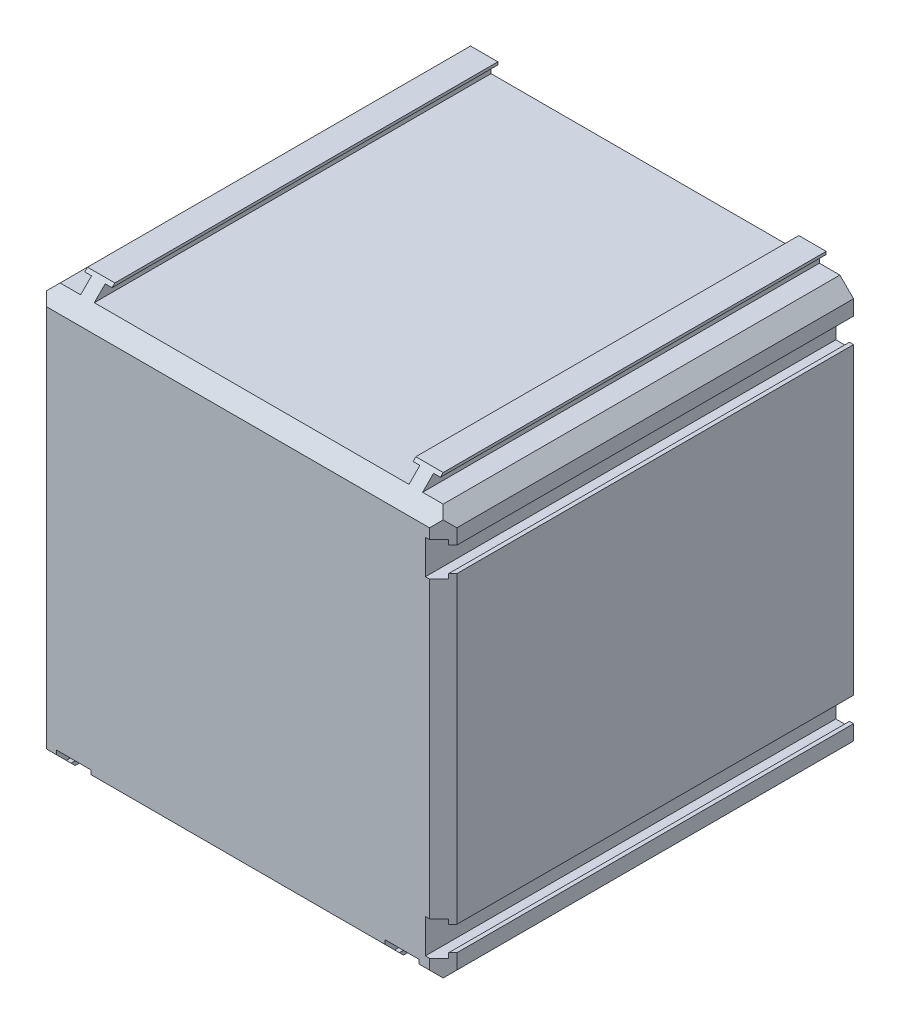
from build123d import *

# Parameters (mm, degrees)
SKETCH_1_W                      = 30
SKETCH_1_H                      = 30
EXTRUDE_1_DEPTH                 = 30
CHAMFER_6_SIZE                  = 1
EXTRUDE_3_DEPTH                 = 40
PATTERN_CIRCULAR_8_COUNT        = 2
PATTERN_CIRCULAR_8_ANGLE        = 270
PATTERN_CIRCULAR_8_COPY_1_DEPTH = 40
SKETCH_16_W                     = 12.549729198
SKETCH_16_H                     = 35.597789554
CUT_EXTRUDE_8_DEPTH             = 50
SKETCH_17_W                     = 46.119781587
SKETCH_17_H                     = 25.089994046
CUT_EXTRUDE_10_DEPTH            = 50
CUT_EXTRUDE_2_DEPTH             = 30
PATTERN_CIRCULAR_1_COUNT        = 2
PATTERN_CIRCULAR_1_ANGLE        = 270
PATTERN_CIRCULAR_1_COPY_1_DEPTH = 30
CHAMFER_5_SIZE                  = 1
SKETCH_2_W                      = 26
SKETCH_2_H                      = 26
CUT_EXTRUDE_1_DEPTH             = 28
FILLET_1_R                      = 2
CHAMFER_1_SIZE                  = 1.5
CUT_EXTRUDE_3_DEPTH             = 25
SKETCH_12_W                     = 10
SKETCH_12_H                     = 2
EXTRUDE_6_DEPTH                 = 2
SKETCH_13_R                     = 0.5
CUT_EXTRUDE_6_DEPTH             = 40.446165847
SKETCH_14_W                     = 0.5
SKETCH_14_H                     = 0.5
CUT_EXTRUDE_7_DEPTH             = 1
CHAMFER_8_SIZE                  = 0.5
FILLET_6_R                      = 0.3


with BuildPart() as part:
    # 草图1 → 凸台-拉伸1 (new body)
    with BuildSketch(Plane.XY):
        Rectangle(SKETCH_1_W, SKETCH_1_H)
    extrude(amount=EXTRUDE_1_DEPTH)

    # 倒角6
    chamfer_6_edges = [part.edges().sort_by_distance(p)[0] for p in [
        (-15, 0, 30),
        (0, -15, 30),
        (15, 0, 30),
        (0, 15, 30),
    ]]
    chamfer(chamfer_6_edges, length=CHAMFER_6_SIZE)

    # 草图6 → 凸台-拉伸3 (add)
    with BuildSketch(Plane.XY):
        Polygon((-12.5, 15), (-11.5, 15), (-11.5, 15.8), (-11, 15.8), (-11, 16), (-13, 16), (-13, 15.8), (-12.5, 15.8), align=None)
    extrude_3 = extrude(amount=EXTRUDE_3_DEPTH)

    # 镜向4: 凸台-拉伸3 across plane
    add(extrude_3.mirror(Plane(origin=(0, 0, 0), x_dir=(0, 0, 1), z_dir=(1, 0, 0))))

    # 阵列(圆周)8: 凸台-拉伸3 ×2 about axis
    pattern_circular_8_axis = Axis((0, 0, 0), (0, 0, -1))
    for i in range(1, PATTERN_CIRCULAR_8_COUNT):
        add(extrude_3.rotate(pattern_circular_8_axis, i * PATTERN_CIRCULAR_8_ANGLE / (PATTERN_CIRCULAR_8_COUNT - 1)))

    # 阵列(圆周)8 copy 1 sketch → 阵列(圆周)8 copy 1 (add)
    with BuildSketch(Plane(origin=(0, 0, 0), x_dir=(0, -1, 0), z_dir=(0, 0, 1))):
        Polygon((-12.5, -15), (-11.5, -15), (-11.5, -15.8), (-11, -15.8), (-11, -16), (-13, -16), (-13, -15.8), (-12.5, -15.8), align=None)
    extrude(amount=PATTERN_CIRCULAR_8_COPY_1_DEPTH)

    # 草图16 → 切除-拉伸8 (cut, along a direction that is not the sketch's normal)
    with BuildSketch(Plane(origin=(-22, 0, 22), x_dir=(0.7071067811865475, 0, 0.7071067811865477), z_dir=(-0.7071067811865477, 0, 0.7071067811865475))):
        with Locations((10.913675879, 1.48547553)):
            Rectangle(SKETCH_16_W, SKETCH_16_H)
    extrude(amount=CUT_EXTRUDE_8_DEPTH, dir=(0, 0, 1), mode=Mode.SUBTRACT)

    # 草图17 → 切除-拉伸10 (cut, along a direction that is not the sketch's normal)
    with BuildSketch(Plane(origin=(0, 22, 22), x_dir=(1, 0, 0), z_dir=(0, 0.7071067811865477, 0.7071067811865475))):
        with Locations((-2.061617887, -8.781830855)):
            Rectangle(SKETCH_17_W, SKETCH_17_H)
    extrude(amount=CUT_EXTRUDE_10_DEPTH, dir=(0, 0, 1), mode=Mode.SUBTRACT)

    # 草图8 → 切除-拉伸2 (cut)
    with BuildSketch(Plane.XY.offset(30)):
        Polygon((-12.9, -15), (-11.1, -15), (-11.1, -14.7), (-10.75, -14.7), (-10.75, -13.7), (-13.25, -13.7), (-13.25, -14.7), (-12.9, -14.7), align=None)
    cut_extrude_2 = extrude(amount=-CUT_EXTRUDE_2_DEPTH, mode=Mode.SUBTRACT)

    # 镜向1: 切除-拉伸2 across plane
    add(cut_extrude_2.mirror(Plane(origin=(0, 0, 0), x_dir=(0, 0, 1), z_dir=(1, 0, 0))), mode=Mode.SUBTRACT)

    # 阵列(圆周)1: 切除-拉伸2 ×2 about axis
    pattern_circular_1_axis = Axis((0, 0, 0), (0, 0, -1))
    for i in range(1, PATTERN_CIRCULAR_1_COUNT):
        add(cut_extrude_2.rotate(pattern_circular_1_axis, i * PATTERN_CIRCULAR_1_ANGLE / (PATTERN_CIRCULAR_1_COUNT - 1)), mode=Mode.SUBTRACT)

    # 阵列(圆周)1 copy 1 sketch → 阵列(圆周)1 copy 1 (cut)
    with BuildSketch(Plane(origin=(0, 0, 30), x_dir=(0, -1, 0), z_dir=(0, 0, 1))):
        Polygon((-12.9, 15), (-11.1, 15), (-11.1, 14.7), (-10.75, 14.7), (-10.75, 13.7), (-13.25, 13.7), (-13.25, 14.7), (-12.9, 14.7), align=None)
    extrude(amount=-PATTERN_CIRCULAR_1_COPY_1_DEPTH, mode=Mode.SUBTRACT)

    # 倒角5
    chamfer_5_edges = [part.edges().sort_by_distance(p)[0] for p in [
        (15, -15, 14.5),
        (-15, -15, 14.5),
        (15, 15, 14.5),
        (-15, 15, 14.5),
    ]]
    chamfer(chamfer_5_edges, length=CHAMFER_5_SIZE)

    # 草图2 → 切除-拉伸1 (cut)
    with BuildSketch(Plane(origin=(0, 0, 0), x_dir=(-1, 0, 0), z_dir=(0, 0, -1))):
        Rectangle(SKETCH_2_W, SKETCH_2_H)
    extrude(amount=-CUT_EXTRUDE_1_DEPTH, mode=Mode.SUBTRACT)

    # 圆角1
    fillet_1_edges = [part.edges().sort_by_distance(p)[0] for p in [
        (13, -13, 14),
        (-13, -13, 14),
    ]]
    fillet(fillet_1_edges, radius=FILLET_1_R)

    # 倒角1
    chamfer_1_edges = [part.edges().sort_by_distance(p)[0] for p in [
        (13, 13, 14),
        (-13, 13, 14),
    ]]
    chamfer(chamfer_1_edges, length=CHAMFER_1_SIZE)

    # 草图9 → 切除-拉伸3 (cut)
    with BuildSketch(Plane(origin=(0, 0, 0), x_dir=(-1, 0, 0), z_dir=(0, 0, -1))):
        with BuildLine():
            Line((12.397056275, 14.2), (13.8, 14.2))
            ThreePointArc((13.8, 14.2), (14.082842712, 14.082842712), (14.2, 13.8))
            Line((14.2, 13.8), (14.2, 12.397056275))
            ThreePointArc((14.2, 12.397056275), (13.953073373, 12.027504462), (13.517157288, 12.114213562))
            Line((13.517157288, 12.114213562), (12.114213562, 13.517157288))
            ThreePointArc((12.114213562, 13.517157288), (12.027504462, 13.953073373), (12.397056275, 14.2))
        make_face()
    extrude(amount=-CUT_EXTRUDE_3_DEPTH, mode=Mode.SUBTRACT)

    # 草图12 → 凸台-拉伸6 (add)
    with BuildSketch(Plane(origin=(0, 0, 0), x_dir=(-1, 0, 0), z_dir=(0, 0, -1))):
        with Locations((0, -14)):
            Rectangle(SKETCH_12_W, SKETCH_12_H)
    extrude(amount=EXTRUDE_6_DEPTH)

    # 草图13 → 切除-拉伸6 (cut, through all)
    with BuildSketch(Plane.ZY.offset(5)):
        with Locations(Location((-1, -14, 0), (0, 0, 270))):
            Circle(SKETCH_13_R)
    extrude(amount=-CUT_EXTRUDE_6_DEPTH, mode=Mode.SUBTRACT)

    # 草图14 → 切除-拉伸7 (cut)
    with BuildSketch(Plane(origin=(0, 0, -2), x_dir=(-1, 0, 0), z_dir=(0, 0, -1))):
        with Locations((-4.75, -14)):
            Rectangle(SKETCH_14_W, SKETCH_14_H)
        with Locations((4.75, -14)):
            Rectangle(SKETCH_14_W, SKETCH_14_H)
    extrude(amount=-CUT_EXTRUDE_7_DEPTH, mode=Mode.SUBTRACT)

    # 倒角8
    chamfer_8_edges = [part.edges().sort_by_distance(p)[0] for p in [
        (0, -15, -2),
        (0, -13, -2),
    ]]
    chamfer(chamfer_8_edges, length=CHAMFER_8_SIZE)

    # 圆角6
    # the kernel refuses this fillet: 0.3 mm, written as the material it takes off along each edge
    with BuildSketch(Plane(origin=(-4.5, -14.25, -1.433012702), x_dir=(0, -0.8016059252125737, 0.5978527750743438), z_dir=(-1, 0, 0))) as fillet_6_piece_1:
        with BuildLine():
            CenterArc((0.152038547, -0.297941245), FILLET_6_R, 96.716268279, 46.567463442)
            Line((-0.088443231, -0.118585412), (-0.093252866, -0.114998296))
            Line((-0.093252866, -0.114998296), (-0.004809636, 0.003587117))
            Line((-0.004809636, 0.003587117), (0.000701716, 0.005958825))
            ThreePointArc((0.000701716, 0.005958825), (0.058476364, 0.002568741), (0.116251012, 0.005958825))
            Line((0.116251012, 0.005958825), (0.116952728, 0))
        make_face()
    extrude(amount=0.869837, mode=Mode.SUBTRACT)
    with BuildSketch(Plane(origin=(-4.5, -13.75, -1.433012702), x_dir=(0, 0.8016059252125791, 0.5978527750743364), z_dir=(-1, 0, 0)), Plane(origin=(5.369837, -13.75, -1.433012702), x_dir=(0, 0.8016059252125827, 0.5978527750743317), z_dir=(-1, 0, 0))) as fillet_6_piece_2:
        with BuildLine():
            CenterArc((0.152038547, 0.297941245), FILLET_6_R, 216.716268279, 46.567463442)
            Line((-0.088443231, 0.118585412), (-0.093252866, 0.114998296))
            Line((-0.093252866, 0.114998296), (-0.004809636, -0.003587117))
            Line((-0.004809636, -0.003587117), (0.000701716, -0.005958825))
            ThreePointArc((0.000701716, -0.005958825), (0.058476364, -0.002568741), (0.116251012, -0.005958825))
            Line((0.116251012, -0.005958825), (0.116952728, 0))
        make_face()
    extrude(amount=0.869837, mode=Mode.SUBTRACT)
    with BuildSketch(Plane(origin=(-5.739509973, -14.25, -2), x_dir=(0, -1, 0), z_dir=(1, 0, 0)), Plane(origin=(-4.5, -13.75, -2), x_dir=(0, 1, 0), z_dir=(-1, 0, 0)), Plane(origin=(4.5, -14.25, -2), x_dir=(0, -1, 0), z_dir=(1, 0, 0)), Plane(origin=(5.739509973, -13.75, -2), x_dir=(0, 1, 0), z_dir=(-1, 0, 0))) as fillet_6_piece_3:
        with BuildLine():
            CenterArc((0.3, -0.295803989), FILLET_6_R, 99.594068227, 80.405931773)
            Line((0, -0.295803989), (-0.006, -0.295803989))
            Line((-0.006, -0.295803989), (-0.006, 0))
            Line((-0.006, 0), (0, 0.006))
            ThreePointArc((0, 0.006), (0.125, 0.006), (0.249, 0.00591608))
            Line((0.249, 0.00591608), (0.25, 0))
        make_face()
    extrude(amount=1.239509973, mode=Mode.SUBTRACT)
    with BuildSketch(Plane(origin=(5.369837, -14.25, -1.433012702), x_dir=(0, 0, -1), z_dir=(-1, 0, 0))) as fillet_6_piece_4:
        with BuildLine():
            CenterArc((0.1479348, 0.3), FILLET_6_R, 223.432536558, 46.567463442)
            Line((-0.069920513, 0.09375), (-0.074277619, 0.089625))
            ThreePointArc((-0.074277619, 0.089625), (-0.037019375, 0.045339271), (-0.005196152, -0.003))
            Line((-0.005196152, -0.003), (0, -0.006))
            Line((0, -0.006), (0.1479348, -0.006))
            Line((0.1479348, -0.006), (0.1479348, 0))
        make_face()
    extrude(amount=0.869837, mode=Mode.SUBTRACT)


solid = part.part
